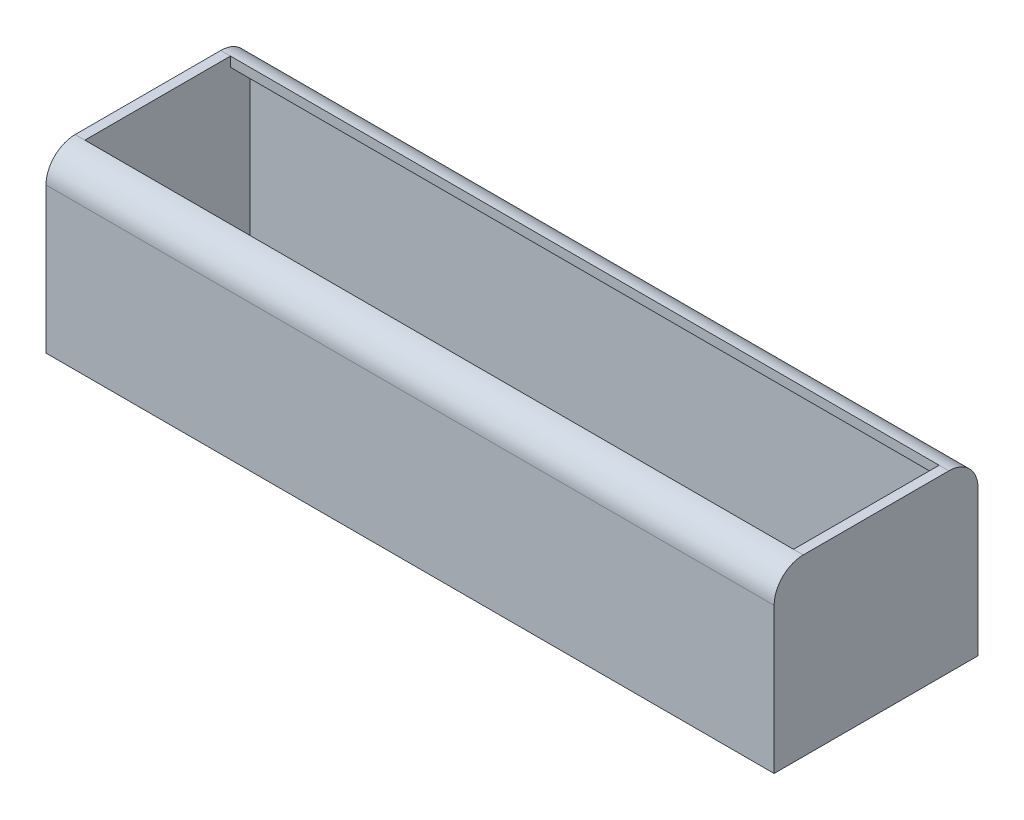
from build123d import *

# Parameters (mm, degrees)
BOSS_EXTRUDE1_DEPTH = 75
SHELL1_START        = 1
SHELL1_DEPTH        = 73


# Read off the part's stored shape, not the designer's step: Shell1
with BuildPart() as part:
    # Sketch2 → Boss-Extrude1 (new body)
    with BuildSketch(Plane(origin=(0, 0, 0), x_dir=(0, 0, -1), z_dir=(1, 0, 0))):
        with BuildLine():
            Line((-10.5, -9), (10.5, -9))
            Line((10.5, -9), (10.5, 6))
            ThreePointArc((10.5, 6), (9.621320344, 8.121320344), (7.5, 9))
            Line((7.5, 9), (-7.5, 9))
            ThreePointArc((-7.5, 9), (-9.621320344, 8.121320344), (-10.5, 6))
            Line((-10.5, 6), (-10.5, -9))
        make_face()
    extrude(amount=BOSS_EXTRUDE1_DEPTH)

    # Shell1 outline → Shell1 (cut)
    with BuildSketch(Plane.YZ.offset(SHELL1_START)):
        with BuildLine():
            Line((8, -7.5), (9, -7.5))
            Line((9, -7.5), (9, 7.5))
            Line((9, 7.5), (8, 7.5))
            ThreePointArc((8, 7.5), (7.414213562, 8.914213562), (6, 9.5))
            Line((6, 9.5), (-8, 9.5))
            Line((-8, 9.5), (-8, -9.5))
            Line((-8, -9.5), (6, -9.5))
            ThreePointArc((6, -9.5), (7.414213562, -8.914213562), (8, -7.5))
        make_face()
    extrude(amount=SHELL1_DEPTH, mode=Mode.SUBTRACT)


solid = part.part
